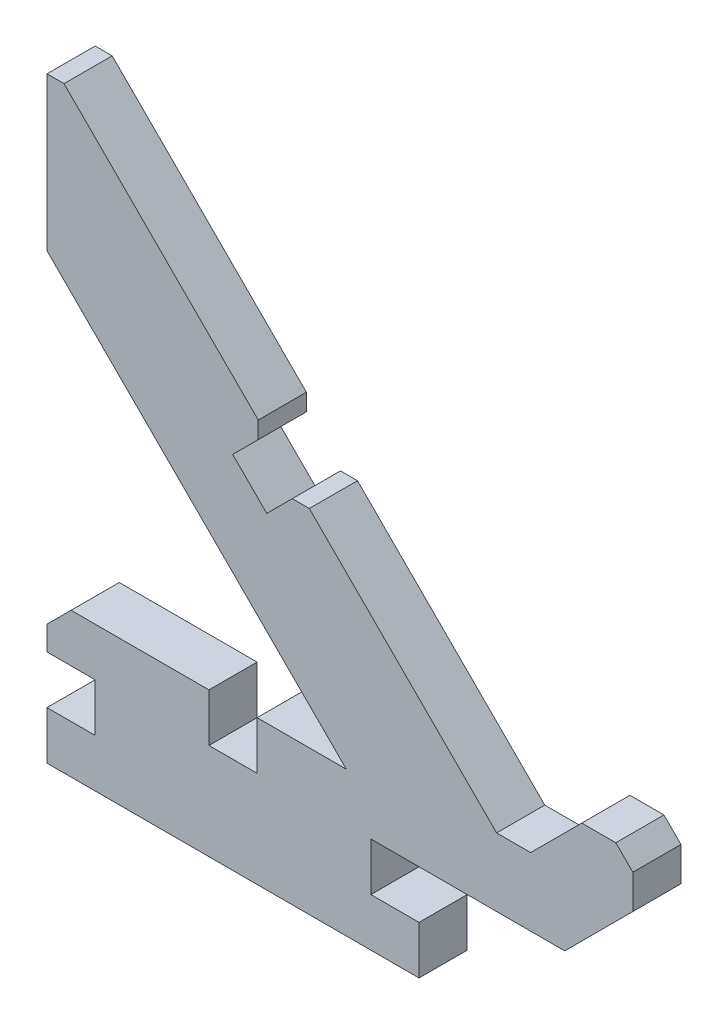
from build123d import *

# Parameters (mm, degrees)
BOSS_EXTRUDE1_DEPTH = 4
CHAMFER1_SIZE       = 2
CHAMFER1_SIZE_2     = 1.414213562
CHAMFER2_SIZE       = 1


with BuildPart() as part:
    # Sketch1 → Boss-Extrude1 (new body)
    with BuildSketch(Plane.XY):
        Polygon((0, 4), (0, 0), (30.9, 0), (30.9, 4), (26.9, 4), (26.9, 8), (43, 8), (38.757359313, 12.242640687), (21.079689783, 29.920310217), (18.251262658, 27.091883092), (15.422835534, 29.920310217), (18.251262658, 32.748737342), (0, 51), (0, 36.857864376), (24.857864376, 12), (20.857864376, 12), (17.45, 12), (17.45, 8), (13.45, 8), (13.45, 12), (0, 12), (0, 8), (4, 8), (4, 4), align=None)
        Polygon((38.757359313, 12.242640687), (43, 8), (50.071067812, 15.071067812), (45.828427125, 19.313708499), align=None)
    extrude(amount=BOSS_EXTRUDE1_DEPTH)

    # Chamfer1
    # the kernel refuses this chamfer: 2, 1.414213562 mm, written as the material it adds along each edge
    with BuildSketch(Plane(origin=(38.757359313, 12.242640687, 0), x_dir=(-0.7262819568766827, 0.6873969152646646, 0), z_dir=(0, 0, 1))) as chamfer1_piece_1:
        Polygon((CHAMFER1_SIZE * 0.999621916911, -CHAMFER1_SIZE * 0.0274958766106), (-CHAMFER1_SIZE * 0.0274958766106, -CHAMFER1_SIZE * 0.999621916911), (0, 0), align=None)
    extrude(amount=4)
    # the kernel refuses this chamfer: 2, 1.414213562 mm, written as the material it takes off along each edge
    with BuildSketch(Plane(origin=(0, 51, -5.143365976), x_dir=(0.7262819568766843, -0.6873969152646628, 0), z_dir=(0, 0, 1))) as chamfer1_2_piece_1:
        Polygon((CHAMFER1_SIZE * 0.999621916911, -CHAMFER1_SIZE * 0.0274958766106), (CHAMFER1_SIZE_2 * 0.687396915446, -CHAMFER1_SIZE_2 * 0.726281957068), (0, 0), align=None)
    extrude(amount=14.286731952, mode=Mode.SUBTRACT)
    with BuildSketch(Plane(origin=(45.828427125, 19.313708499, -5.143365976), x_dir=(0.7262819568766831, -0.6873969152646641, 0), z_dir=(0, 0, 1)), Plane(origin=(50.071067812, 15.071067812, -5.143365976), x_dir=(-0.6873969152646642, -0.726281956876683, 0), z_dir=(0, 0, 1))) as chamfer1_2_piece_2:
        Polygon((CHAMFER1_SIZE * 0.999621916911, -CHAMFER1_SIZE * 0.0274958766106), (-CHAMFER1_SIZE * 0.0274958766106, -CHAMFER1_SIZE * 0.999621916911), (0, 0), align=None)
    extrude(amount=14.286731952, mode=Mode.SUBTRACT)
    with BuildSketch(Plane(origin=(0, 12, -5.143365976), x_dir=(-0.027495876610586365, -0.9996219169112968, 0), z_dir=(0, 0, 1))) as chamfer1_2_piece_3:
        Polygon((CHAMFER1_SIZE * 0.999621916911, CHAMFER1_SIZE * 0.0274958766106), (-CHAMFER1_SIZE * 0.0274958766106, CHAMFER1_SIZE * 0.999621916911), (0, 0), align=None)
    extrude(amount=14.286731952, mode=Mode.SUBTRACT)

    # Chamfer2
    chamfer2_edges = [part.edges().sort_by_distance(p)[0] for p in [
        (18.251262658, 32.748737342, 2),
        (21.079689783, 29.920310217, 2),
    ]]
    chamfer(chamfer2_edges, length=CHAMFER2_SIZE)


solid = part.part
